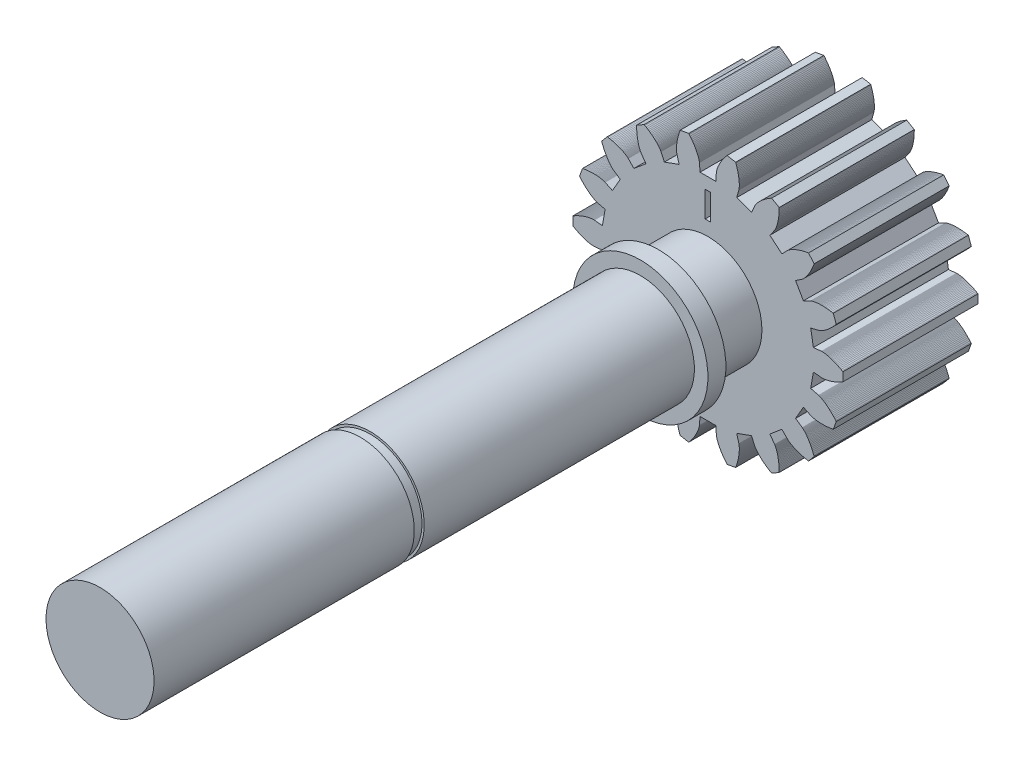
from build123d import *

# Parameters (mm, degrees)
EX_SUN_GEAR_PROFILE_DEPTH = 7.5
SKETCH1_W                 = 0.609653546
SKETCH1_H                 = 2.866842224
CUT_EXTRUDE1_DEPTH        = 1


with BuildPart() as part:
    # SK_Sun_Gear_Profile_DXF → EX_Sun_Gear_Profile (new, symmetric)
    with BuildSketch(Plane.XY):
        Polygon((11.715844, -1.1788231), (12.624043, -1.2701816), (12.6307047, -1.2706619), (12.6421382, -1.2712692), (12.6583493, -1.2718184), (12.6793382, -1.2721246), (12.7050997, -1.2720025), (12.7356234, -1.2712672), (12.7708933, -1.2697341), (12.8108882, -1.2672187), (12.8555814, -1.2635374), (12.9049411, -1.2585073), (12.9589299, -1.2519461), (13.0175052, -1.2436725), (13.0806192, -1.2335066), (13.1482187, -1.2212695), (13.2202453, -1.2067837), (13.2966355, -1.1898733), (13.3773206, -1.1703639), (13.4622268, -1.1480831), (13.5512752, -1.1228603), (13.6443819, -1.0945269), (13.7414581, -1.0629166), (13.84241, -1.0278654), (13.9471389, -0.9892116), (14.0555414, -0.9467962), (14.1675093, -0.9004628), (14.2829298, -0.850058), (14.4016854, -0.795431), (14.5236543, -0.7364343), (14.6487099, -0.6729237), (14.7767214, -0.6047579), (14.9075538, -0.5317993), (14.9739844, -0.4934806), (14.9906948, -0.4837065), (14.9917405, -0.483093), (14.9922286, 0.4827851), (14.9906948, 0.4837065), (14.9739844, 0.4934806), (14.9075538, 0.5317993), (14.7767214, 0.6047579), (14.6487099, 0.6729237), (14.5236543, 0.7364343), (14.4016854, 0.795431), (14.2829298, 0.850058), (14.1675093, 0.9004628), (14.0555414, 0.9467962), (13.9471389, 0.9892116), (13.84241, 1.0278654), (13.7414581, 1.0629166), (13.6443819, 1.0945269), (13.5512752, 1.1228603), (13.4622268, 1.1480831), (13.3773206, 1.1703639), (13.2966355, 1.1898733), (13.2202453, 1.2067837), (13.1482187, 1.2212695), (13.0806192, 1.2335066), (13.0175052, 1.2436725), (12.9589299, 1.2519461), (12.9049411, 1.2585073), (12.8555814, 1.2635374), (12.8108882, 1.2672187), (12.7708933, 1.2697341), (12.7356234, 1.2712672), (12.7050997, 1.2720025), (12.6793382, 1.2721246), (12.6583493, 1.2718184), (12.6421382, 1.2712692), (12.6307047, 1.2706619), (12.624043, 1.2701816), (11.715844, 1.1788231), (11.4124734, 2.8993233), (12.2971477, 3.1240968), (12.3035719, 3.1259238), (12.3145237, 3.1292637), (12.329945, 3.134292), (12.3497728, 3.141183), (12.3739389, 3.1501086), (12.4023703, 3.1612393), (12.4349888, 3.174743), (12.4717114, 3.1907858), (12.5124503, 3.209531), (12.5571128, 3.2311398), (12.6056016, 3.2557706), (12.6578147, 3.2835791), (12.7136455, 3.3147182), (12.7729828, 3.3493377), (12.8357113, 3.3875844), (12.9017109, 3.429602), (12.9708575, 3.4755308), (13.0430227, 3.5255075), (13.1180742, 3.5796656), (13.1958753, 3.6381346), (13.2762857, 3.7010406), (13.3591612, 3.7685055), (13.4443538, 3.8406476), (13.5317119, 3.9175809), (13.6210804, 3.9994153), (13.7123007, 4.0862565), (13.805211, 4.1782059), (13.8996461, 4.2753604), (13.995438, 4.3778124), (14.0924154, 4.4856499), (14.1904043, 4.5989559), (14.239723, 4.6576842), (14.2520826, 4.6725841), (14.2528555, 4.6735183), (13.9229644, 5.5813137), (13.9212079, 5.581655), (13.9021624, 5.5851244), (13.8266322, 5.5984115), (13.6787367, 5.6222229), (13.5351311, 5.6424952), (13.3958954, 5.6594042), (13.2611041, 5.6731271), (13.1308268, 5.6838429), (13.0051275, 5.6917318), (12.8840651, 5.6969757), (12.7676932, 5.6997573), (12.6560598, 5.7002606), (12.5492079, 5.6986704), (12.4471748, 5.6951723), (12.3499925, 5.6899526), (12.2576876, 5.683198), (12.1702814, 5.6750954), (12.0877896, 5.6658323), (12.0102226, 5.6555959), (11.9375853, 5.6445736), (11.8698772, 5.6329523), (11.8070926, 5.6209189), (11.7492201, 5.6086595), (11.6962431, 5.5963598), (11.6481398, 5.5842046), (11.6048828, 5.5723779), (11.5664396, 5.5610625), (11.5327723, 5.5504402), (11.503838, 5.5406914), (11.4795883, 5.5319952), (11.4599699, 5.5245289), (11.4449244, 5.5184682), (11.434388, 5.513987), (11.4282924, 5.5112572), (10.6061109, 5.114786), (9.7325901, 6.6277685), (10.4870349, 7.1415629), (10.4924468, 7.145477), (10.5015958, 7.1523611), (10.5143673, 7.1623607), (10.5306425, 7.1756175), (10.5502985, 7.1922702), (10.5732084, 7.2124537), (10.5992411, 7.2362992), (10.6282622, 7.2639344), (10.6601329, 7.2954826), (10.6947113, 7.3310637), (10.7318517, 7.3707933), (10.7714049, 7.4147826), (10.8132184, 7.463139), (10.8571368, 7.5159653), (10.9030011, 7.5733599), (10.9506495, 7.6354167), (10.9999175, 7.7022252), (11.0506376, 7.7738699), (11.1026398, 7.8504309), (11.1557513, 7.9319834), (11.2097973, 8.0185976), (11.2646004, 8.1103391), (11.3199812, 8.207268), (11.3757582, 8.3094399), (11.4317481, 8.4169049), (11.4877657, 8.5297081), (11.5436243, 8.6478895), (11.5991355, 8.7714836), (11.6541098, 8.9005198), (11.7083562, 9.035022), (11.7616827, 9.175009), (11.7879408, 9.2470636), (11.794459, 9.2652922), (11.7948657, 9.2664343), (11.1743852, 10.0066536), (11.1726179, 10.0063736), (11.1535344, 10.0031197), (11.0780148, 9.9897727), (10.9308945, 9.9615648), (10.7890158, 9.9314986), (10.6523938, 9.8997665), (10.5210379, 9.8665604), (10.3949523, 9.8320725), (10.2741354, 9.796494), (10.1585805, 9.7600158), (10.0482753, 9.7228281), (9.9432021, 9.6851202), (9.843338, 9.6470804), (9.7486546, 9.6088959), (9.6591184, 9.5707527), (9.5746904, 9.5328353), (9.4953267, 9.4953267), (9.4209779, 9.4584083), (9.3515898, 9.4222598), (9.2871029, 9.3870588), (9.2274529, 9.3529809), (9.1725703, 9.3201995), (9.1223808, 9.2888859), (9.0768056, 9.2592088), (9.0357605, 9.2313343), (8.9991572, 9.205426), (8.9669025, 9.1816447), (8.9388987, 9.1601481), (8.9150436, 9.1410912), (8.8952306, 9.1246255), (8.879349, 9.1108996), (8.8672837, 9.1000585), (8.8589154, 9.0922439), (8.854121, 9.0875939), (8.2171243, 8.4338303), (6.8788128, 9.556807), (7.412031, 10.2976511), (7.4157778, 10.3031802), (7.4220205, 10.3127783), (7.4306018, 10.3265429), (7.4413613, 10.3445667), (7.4541364, 10.3669379), (7.4687614, 10.3937398), (7.4850686, 10.425051), (7.5028877, 10.4609453), (7.5220462, 10.5014914), (7.5423698, 10.5467532), (7.563682, 10.5967895), (7.5858046, 10.651654), (7.6085577, 10.7113952), (7.6317598, 10.7760566), (7.655228, 10.8456764), (7.6787782, 10.9202875), (7.7022252, 10.9999175), (7.7253825, 11.0845888), (7.7480631, 11.1743184), (7.7700791, 11.2691179), (7.7912419, 11.3689935), (7.8113625, 11.473946), (7.8302518, 11.5839708), (7.8477202, 11.6990578), (7.8635783, 11.8191915), (7.8776367, 11.9443511), (7.8897062, 12.07451), (7.899598, 12.2096364), (7.9071239, 12.349693), (7.9120964, 12.4946372), (7.9143286, 12.6444207), (7.9143589, 12.7211106), (7.9142495, 12.7404692), (7.9142411, 12.7416816), (7.0780102, 13.2250434), (7.0764453, 13.2241758), (7.0596255, 13.2145912), (6.9932252, 13.1762199), (6.864625, 13.099395), (6.7415859, 13.0226167), (6.6240563, 12.9460707), (6.5119793, 12.8699409), (6.4052931, 12.794409), (6.303931, 12.7196544), (6.2078211, 12.645854), (6.1168871, 12.5731824), (6.0310474, 12.5018114), (5.9502163, 12.4319101), (5.8743029, 12.3636448), (5.8032121, 12.2971787), (5.7368443, 12.232672), (5.6750954, 12.1702814), (5.6178573, 12.1101608), (5.5650173, 12.0524601), (5.5164589, 11.9973261), (5.4720615, 11.9449019), (5.4317006, 11.8953265), (5.3952479, 11.8487355), (5.3625713, 11.8052605), (5.3335352, 11.7650288), (5.3080005, 11.728164), (5.2858247, 11.694785), (5.266862, 11.665007), (5.2509634, 11.6389404), (5.2379769, 11.6166913), (5.2277476, 11.5983613), (5.2201177, 11.5840475), (5.2149269, 11.573842), (5.212012, 11.5678327), (4.8370312, 10.7356301), (3.1953491, 11.3331535), (3.4430267, 12.2116907), (3.4446565, 12.2181678), (3.44724, 12.2293222), (3.450596, 12.2451916), (3.4545422, 12.2658085), (3.4588954, 12.2911998), (3.4634716, 12.3213874), (3.4680863, 12.3563877), (3.4725542, 12.3962118), (3.4766898, 12.4408653), (3.4803072, 12.4903486), (3.4832207, 12.5446565), (3.4852444, 12.6037786), (3.4861926, 12.667699), (3.4858799, 12.7363965), (3.4841215, 12.8098443), (3.4807329, 12.8880104), (3.4755308, 12.9708575), (3.4683323, 13.0583428), (3.4589558, 13.1504183), (3.4472206, 13.2470305), (3.4329477, 13.348121), (3.4159591, 13.4536257), (3.3960785, 13.5634757), (3.3731314, 13.6775967), (3.3469449, 13.7959093), (3.3173484, 13.918329), (3.284173, 14.0447663), (3.2472523, 14.1751269), (3.2064222, 14.3093111), (3.161521, 14.4472147), (3.1123896, 14.5887286), (3.0861886, 14.660804), (3.0794648, 14.6789577), (3.0790422, 14.6800941), (2.1279227, 14.8482977), (2.1267489, 14.8469472), (2.1142216, 14.832188), (2.0649495, 14.7734205), (1.9703805, 14.6572449), (1.8810213, 14.543015), (1.7967599, 14.4308878), (1.7174798, 14.3210166), (1.6430611, 14.213551), (1.5733794, 14.1086367), (1.5083069, 14.0064155), (1.447712, 13.9070253), (1.3914595, 13.8105996), (1.3394106, 13.717268), (1.2914235, 13.6271557), (1.2473527, 13.5403835), (1.20705, 13.4570679), (1.1703639, 13.3773206), (1.1371401, 13.301249), (1.1072215, 13.2289558), (1.0804485, 13.1605389), (1.0566588, 13.0960914), (1.0356877, 13.0357016), (1.0173684, 12.9794528), (1.0015318, 12.9274236), (0.9880068, 12.8796873), (0.9766206, 12.8363122), (0.9671984, 12.7973617), (0.959564, 12.7628939), (0.9535395, 12.7329616), (0.9489458, 12.7076127), (0.9456026, 12.6868895), (0.9433285, 12.6708293), (0.9419412, 12.659464), (0.9412574, 12.6528201), (0.8735208, 11.7425545), (-0.8735208, 11.7425545), (-0.9412574, 12.6528201), (-0.9419412, 12.659464), (-0.9433285, 12.6708293), (-0.9456026, 12.6868895), (-0.9489458, 12.7076127), (-0.9535395, 12.7329616), (-0.959564, 12.7628939), (-0.9671984, 12.7973617), (-0.9766206, 12.8363122), (-0.9880068, 12.8796873), (-1.0015318, 12.9274236), (-1.0173684, 12.9794528), (-1.0356877, 13.0357016), (-1.0566588, 13.0960914), (-1.0804485, 13.1605389), (-1.1072215, 13.2289558), (-1.1371401, 13.301249), (-1.1703639, 13.3773206), (-1.20705, 13.4570679), (-1.2473527, 13.5403835), (-1.2914235, 13.6271557), (-1.3394106, 13.717268), (-1.3914595, 13.8105996), (-1.447712, 13.9070253), (-1.5083069, 14.0064155), (-1.5733794, 14.1086367), (-1.6430611, 14.213551), (-1.7174798, 14.3210166), (-1.7967599, 14.4308878), (-1.8810213, 14.543015), (-1.9703805, 14.6572449), (-2.0649495, 14.7734205), (-2.1142216, 14.832188), (-2.1267489, 14.8469472), (-2.1275347, 14.8478705), (-3.0788237, 14.6806282), (-3.0794648, 14.6789577), (-3.0861886, 14.660804), (-3.1123896, 14.5887286), (-3.161521, 14.4472147), (-3.2064222, 14.3093111), (-3.2472523, 14.1751269), (-3.284173, 14.0447663), (-3.3173484, 13.918329), (-3.3469449, 13.7959093), (-3.3731314, 13.6775967), (-3.3960785, 13.5634757), (-3.4159591, 13.4536257), (-3.4329477, 13.348121), (-3.4472206, 13.2470305), (-3.4589558, 13.1504183), (-3.4683323, 13.0583428), (-3.4755308, 12.9708575), (-3.4807329, 12.8880104), (-3.4841215, 12.8098443), (-3.4858799, 12.7363965), (-3.4861926, 12.667699), (-3.4852444, 12.6037786), (-3.4832207, 12.5446565), (-3.4803072, 12.4903486), (-3.4766898, 12.4408653), (-3.4725542, 12.3962118), (-3.4680863, 12.3563877), (-3.4634716, 12.3213874), (-3.4588954, 12.2911998), (-3.4545422, 12.2658085), (-3.450596, 12.2451916), (-3.44724, 12.2293222), (-3.4446565, 12.2181678), (-3.4430267, 12.2116907), (-3.1953491, 11.3331535), (-4.8370312, 10.7356301), (-5.212012, 11.5678327), (-5.2149269, 11.573842), (-5.2201177, 11.5840475), (-5.2277476, 11.5983613), (-5.2379769, 11.6166913), (-5.2509634, 11.6389404), (-5.266862, 11.665007), (-5.2858247, 11.694785), (-5.3080005, 11.728164), (-5.3335352, 11.7650288), (-5.3625713, 11.8052605), (-5.3952479, 11.8487355), (-5.4317006, 11.8953265), (-5.4720615, 11.9449019), (-5.5164589, 11.9973261), (-5.5650173, 12.0524601), (-5.6178573, 12.1101608), (-5.6750954, 12.1702814), (-5.7368443, 12.232672), (-5.8032121, 12.2971787), (-5.8743029, 12.3636448), (-5.9502163, 12.4319101), (-6.0310474, 12.5018114), (-6.1168871, 12.5731824), (-6.2078211, 12.645854), (-6.303931, 12.7196544), (-6.4052931, 12.794409), (-6.5119793, 12.8699409), (-6.6240563, 12.9460707), (-6.7415859, 13.0226167), (-6.864625, 13.099395), (-6.9932252, 13.1762199), (-7.0596255, 13.2145912), (-7.0764453, 13.2241758), (-7.0774994, 13.2247747), (-7.9142184, 12.7422583), (-7.9142495, 12.7404692), (-7.9143589, 12.7211106), (-7.9143286, 12.6444207), (-7.9120964, 12.4946372), (-7.9071239, 12.349693), (-7.899598, 12.2096364), (-7.8897062, 12.07451), (-7.8776367, 11.9443511), (-7.8635783, 11.8191915), (-7.8477202, 11.6990578), (-7.8302518, 11.5839708), (-7.8113625, 11.473946), (-7.7912419, 11.3689935), (-7.7700791, 11.2691179), (-7.7480631, 11.1743184), (-7.7253825, 11.0845888), (-7.7022252, 10.9999175), (-7.6787782, 10.9202875), (-7.655228, 10.8456764), (-7.6317598, 10.7760566), (-7.6085577, 10.7113952), (-7.5858046, 10.651654), (-7.563682, 10.5967895), (-7.5423698, 10.5467532), (-7.5220462, 10.5014914), (-7.5028877, 10.4609453), (-7.4850686, 10.425051), (-7.4687614, 10.3937398), (-7.4541364, 10.3669379), (-7.4413613, 10.3445667), (-7.4306018, 10.3265429), (-7.4220205, 10.3127783), (-7.4157778, 10.3031802), (-7.412031, 10.2976511), (-6.8788128, 9.556807), (-8.2171243, 8.4338303), (-8.854121, 9.0875939), (-8.8589154, 9.0922439), (-8.8672837, 9.1000585), (-8.879349, 9.1108996), (-8.8952306, 9.1246255), (-8.9150436, 9.1410912), (-8.9388987, 9.1601481), (-8.9669025, 9.1816447), (-8.9991572, 9.205426), (-9.0357605, 9.2313343), (-9.0768056, 9.2592088), (-9.1223808, 9.2888859), (-9.1725703, 9.3201995), (-9.2274529, 9.3529809), (-9.2871029, 9.3870588), (-9.3515898, 9.4222598), (-9.4209779, 9.4584083), (-9.4953267, 9.4953267), (-9.5746904, 9.5328353), (-9.6591184, 9.5707527), (-9.7486546, 9.6088959), (-9.843338, 9.6470804), (-9.9432021, 9.6851202), (-10.0482753, 9.7228281), (-10.1585805, 9.7600158), (-10.2741354, 9.796494), (-10.3949523, 9.8320725), (-10.5210379, 9.8665604), (-10.6523938, 9.8997665), (-10.7890158, 9.9314986), (-10.9308945, 9.9615648), (-11.0780148, 9.9897727), (-11.1535344, 10.0031197), (-11.1726179, 10.0063736), (-11.1738133, 10.0065758), (-11.7950417, 9.266984), (-11.794459, 9.2652922), (-11.7879408, 9.2470636), (-11.7616827, 9.175009), (-11.7083562, 9.035022), (-11.6541098, 8.9005198), (-11.5991355, 8.7714836), (-11.5436243, 8.6478895), (-11.4877657, 8.5297081), (-11.4317481, 8.4169049), (-11.3757582, 8.3094399), (-11.3199812, 8.207268), (-11.2646004, 8.1103391), (-11.2097973, 8.0185976), (-11.1557513, 7.9319834), (-11.1026398, 7.8504309), (-11.0506376, 7.7738699), (-10.9999175, 7.7022252), (-10.9506495, 7.6354167), (-10.9030011, 7.5733599), (-10.8571368, 7.5159653), (-10.8132184, 7.463139), (-10.7714049, 7.4147826), (-10.7318517, 7.3707933), (-10.6947113, 7.3310637), (-10.6601329, 7.2954826), (-10.6282622, 7.2639344), (-10.5992411, 7.2362992), (-10.5732084, 7.2124537), (-10.5502985, 7.1922702), (-10.5306425, 7.1756175), (-10.5143673, 7.1623607), (-10.5015958, 7.1523611), (-10.4924468, 7.145477), (-10.4870349, 7.1415629), (-9.7325901, 6.6277685), (-10.6061109, 5.114786), (-11.4282924, 5.5112572), (-11.434388, 5.513987), (-11.4449244, 5.5184682), (-11.4599699, 5.5245289), (-11.4795883, 5.5319952), (-11.503838, 5.5406914), (-11.5327723, 5.5504402), (-11.5664396, 5.5610625), (-11.6048828, 5.5723779), (-11.6481398, 5.5842046), (-11.6962431, 5.5963598), (-11.7492201, 5.6086595), (-11.8070926, 5.6209189), (-11.8698772, 5.6329523), (-11.9375853, 5.6445736), (-12.0102226, 5.6555959), (-12.0877896, 5.6658323), (-12.1702814, 5.6750954), (-12.2576876, 5.683198), (-12.3499925, 5.6899526), (-12.4471748, 5.6951723), (-12.5492079, 5.6986704), (-12.6560598, 5.7002606), (-12.7676932, 5.6997573), (-12.8840651, 5.6969757), (-13.0051275, 5.6917318), (-13.1308268, 5.6838429), (-13.2611041, 5.6731271), (-13.3958954, 5.6594042), (-13.5351311, 5.6424952), (-13.6787367, 5.6222229), (-13.8266322, 5.5984115), (-13.9021624, 5.5851244), (-13.9212079, 5.581655), (-13.9224004, 5.5814362), (-14.2532088, 4.6739746), (-14.2520826, 4.6725841), (-14.239723, 4.6576842), (-14.1904043, 4.5989559), (-14.0924154, 4.4856499), (-13.995438, 4.3778124), (-13.8996461, 4.2753604), (-13.805211, 4.1782059), (-13.7123007, 4.0862565), (-13.6210804, 3.9994153), (-13.5317119, 3.9175809), (-13.4443538, 3.8406476), (-13.3591612, 3.7685055), (-13.2762857, 3.7010406), (-13.1958753, 3.6381346), (-13.1180742, 3.5796656), (-13.0430227, 3.5255075), (-12.9708575, 3.4755308), (-12.9017109, 3.429602), (-12.8357113, 3.3875844), (-12.7729828, 3.3493377), (-12.7136455, 3.3147182), (-12.6578147, 3.2835791), (-12.6056016, 3.2557706), (-12.5571128, 3.2311398), (-12.5124503, 3.209531), (-12.4717114, 3.1907858), (-12.4349888, 3.174743), (-12.4023703, 3.1612393), (-12.3739389, 3.1501086), (-12.3497728, 3.141183), (-12.329945, 3.134292), (-12.3145237, 3.1292637), (-12.3035719, 3.1259238), (-12.2971477, 3.1240968), (-11.4124734, 2.8993233), (-11.715844, 1.1788231), (-12.624043, 1.2701816), (-12.6307047, 1.2706619), (-12.6421382, 1.2712692), (-12.6583493, 1.2718184), (-12.6793382, 1.2721246), (-12.7050997, 1.2720025), (-12.7356234, 1.2712672), (-12.7708933, 1.2697341), (-12.8108882, 1.2672187), (-12.8555814, 1.2635374), (-12.9049411, 1.2585073), (-12.9589299, 1.2519461), (-13.0175052, 1.2436725), (-13.0806192, 1.2335066), (-13.1482187, 1.2212695), (-13.2202453, 1.2067837), (-13.2966355, 1.1898733), (-13.3773206, 1.1703639), (-13.4622268, 1.1480831), (-13.5512752, 1.1228603), (-13.6443819, 1.0945269), (-13.7414581, 1.0629166), (-13.84241, 1.0278654), (-13.9471389, 0.9892116), (-14.0555414, 0.9467962), (-14.1675093, 0.9004628), (-14.2829298, 0.850058), (-14.4016854, 0.795431), (-14.5236543, 0.7364343), (-14.6487099, 0.6729237), (-14.7767214, 0.6047579), (-14.9075538, 0.5317993), (-14.9739844, 0.4934806), (-14.9906948, 0.4837065), (-14.9917405, 0.483093), (-14.9922286, -0.4827851), (-14.9906948, -0.4837065), (-14.9739844, -0.4934806), (-14.9075538, -0.5317993), (-14.7767214, -0.6047579), (-14.6487099, -0.6729237), (-14.5236543, -0.7364343), (-14.4016854, -0.795431), (-14.2829298, -0.850058), (-14.1675093, -0.9004628), (-14.0555414, -0.9467962), (-13.9471389, -0.9892116), (-13.84241, -1.0278654), (-13.7414581, -1.0629166), (-13.6443819, -1.0945269), (-13.5512752, -1.1228603), (-13.4622268, -1.1480831), (-13.3773206, -1.1703639), (-13.2966355, -1.1898733), (-13.2202453, -1.2067837), (-13.1482187, -1.2212695), (-13.0806192, -1.2335066), (-13.0175052, -1.2436725), (-12.9589299, -1.2519461), (-12.9049411, -1.2585073), (-12.8555814, -1.2635374), (-12.8108882, -1.2672187), (-12.7708933, -1.2697341), (-12.7356234, -1.2712672), (-12.7050997, -1.2720025), (-12.6793382, -1.2721246), (-12.6583493, -1.2718184), (-12.6421382, -1.2712692), (-12.6307047, -1.2706619), (-12.624043, -1.2701816), (-11.715844, -1.1788231), (-11.4124734, -2.8993233), (-12.2971477, -3.1240968), (-12.3035719, -3.1259238), (-12.3145237, -3.1292637), (-12.329945, -3.134292), (-12.3497728, -3.141183), (-12.3739389, -3.1501086), (-12.4023703, -3.1612393), (-12.4349888, -3.174743), (-12.4717114, -3.1907858), (-12.5124503, -3.209531), (-12.5571128, -3.2311398), (-12.6056016, -3.2557706), (-12.6578147, -3.2835791), (-12.7136455, -3.3147182), (-12.7729828, -3.3493377), (-12.8357113, -3.3875844), (-12.9017109, -3.429602), (-12.9708575, -3.4755308), (-13.0430227, -3.5255075), (-13.1180742, -3.5796656), (-13.1958753, -3.6381346), (-13.2762857, -3.7010406), (-13.3591612, -3.7685055), (-13.4443538, -3.8406476), (-13.5317119, -3.9175809), (-13.6210804, -3.9994153), (-13.7123007, -4.0862565), (-13.805211, -4.1782059), (-13.8996461, -4.2753604), (-13.995438, -4.3778124), (-14.0924154, -4.4856499), (-14.1904043, -4.5989559), (-14.239723, -4.6576842), (-14.2520826, -4.6725841), (-14.2528555, -4.6735183), (-13.9229644, -5.5813137), (-13.9212079, -5.581655), (-13.9021624, -5.5851244), (-13.8266322, -5.5984115), (-13.6787367, -5.6222229), (-13.5351311, -5.6424952), (-13.3958954, -5.6594042), (-13.2611041, -5.6731271), (-13.1308268, -5.6838429), (-13.0051275, -5.6917318), (-12.8840651, -5.6969757), (-12.7676932, -5.6997573), (-12.6560598, -5.7002606), (-12.5492079, -5.6986704), (-12.4471748, -5.6951723), (-12.3499925, -5.6899526), (-12.2576876, -5.683198), (-12.1702814, -5.6750954), (-12.0877896, -5.6658323), (-12.0102226, -5.6555959), (-11.9375853, -5.6445736), (-11.8698772, -5.6329523), (-11.8070926, -5.6209189), (-11.7492201, -5.6086595), (-11.6962431, -5.5963598), (-11.6481398, -5.5842046), (-11.6048828, -5.5723779), (-11.5664396, -5.5610625), (-11.5327723, -5.5504402), (-11.503838, -5.5406914), (-11.4795883, -5.5319952), (-11.4599699, -5.5245289), (-11.4449244, -5.5184682), (-11.434388, -5.513987), (-11.4282924, -5.5112572), (-10.6061109, -5.114786), (-9.7325901, -6.6277685), (-10.4870349, -7.1415629), (-10.4924468, -7.145477), (-10.5015958, -7.1523611), (-10.5143673, -7.1623607), (-10.5306425, -7.1756175), (-10.5502985, -7.1922702), (-10.5732084, -7.2124537), (-10.5992411, -7.2362992), (-10.6282622, -7.2639344), (-10.6601329, -7.2954826), (-10.6947113, -7.3310637), (-10.7318517, -7.3707933), (-10.7714049, -7.4147826), (-10.8132184, -7.463139), (-10.8571368, -7.5159653), (-10.9030011, -7.5733599), (-10.9506495, -7.6354167), (-10.9999175, -7.7022252), (-11.0506376, -7.7738699), (-11.1026398, -7.8504309), (-11.1557513, -7.9319834), (-11.2097973, -8.0185976), (-11.2646004, -8.1103391), (-11.3199812, -8.207268), (-11.3757582, -8.3094399), (-11.4317481, -8.4169049), (-11.4877657, -8.5297081), (-11.5436243, -8.6478895), (-11.5991355, -8.7714836), (-11.6541098, -8.9005198), (-11.7083562, -9.035022), (-11.7616827, -9.175009), (-11.7879408, -9.2470636), (-11.794459, -9.2652922), (-11.7948657, -9.2664343), (-11.1743852, -10.0066536), (-11.1726179, -10.0063736), (-11.1535344, -10.0031197), (-11.0780148, -9.9897727), (-10.9308945, -9.9615648), (-10.7890158, -9.9314986), (-10.6523938, -9.8997665), (-10.5210379, -9.8665604), (-10.3949523, -9.8320725), (-10.2741354, -9.796494), (-10.1585805, -9.7600158), (-10.0482753, -9.7228281), (-9.9432021, -9.6851202), (-9.843338, -9.6470804), (-9.7486546, -9.6088959), (-9.6591184, -9.5707527), (-9.5746904, -9.5328353), (-9.4953267, -9.4953267), (-9.4209779, -9.4584083), (-9.3515898, -9.4222598), (-9.2871029, -9.3870588), (-9.2274529, -9.3529809), (-9.1725703, -9.3201995), (-9.1223808, -9.2888859), (-9.0768056, -9.2592088), (-9.0357605, -9.2313343), (-8.9991572, -9.205426), (-8.9669025, -9.1816447), (-8.9388987, -9.1601481), (-8.9150436, -9.1410912), (-8.8952306, -9.1246255), (-8.879349, -9.1108996), (-8.8672837, -9.1000585), (-8.8589154, -9.0922439), (-8.854121, -9.0875939), (-8.2171243, -8.4338303), (-6.8788128, -9.556807), (-7.412031, -10.2976511), (-7.4157778, -10.3031802), (-7.4220205, -10.3127783), (-7.4306018, -10.3265429), (-7.4413613, -10.3445667), (-7.4541364, -10.3669379), (-7.4687614, -10.3937398), (-7.4850686, -10.425051), (-7.5028877, -10.4609453), (-7.5220462, -10.5014914), (-7.5423698, -10.5467532), (-7.563682, -10.5967895), (-7.5858046, -10.651654), (-7.6085577, -10.7113952), (-7.6317598, -10.7760566), (-7.655228, -10.8456764), (-7.6787782, -10.9202875), (-7.7022252, -10.9999175), (-7.7253825, -11.0845888), (-7.7480631, -11.1743184), (-7.7700791, -11.2691179), (-7.7912419, -11.3689935), (-7.8113625, -11.473946), (-7.8302518, -11.5839708), (-7.8477202, -11.6990578), (-7.8635783, -11.8191915), (-7.8776367, -11.9443511), (-7.8897062, -12.07451), (-7.899598, -12.2096364), (-7.9071239, -12.349693), (-7.9120964, -12.4946372), (-7.9143286, -12.6444207), (-7.9143589, -12.7211106), (-7.9142495, -12.7404692), (-7.9142411, -12.7416816), (-7.0780102, -13.2250434), (-7.0764453, -13.2241758), (-7.0596255, -13.2145912), (-6.9932252, -13.1762199), (-6.864625, -13.099395), (-6.7415859, -13.0226167), (-6.6240563, -12.9460707), (-6.5119793, -12.8699409), (-6.4052931, -12.794409), (-6.303931, -12.7196544), (-6.2078211, -12.645854), (-6.1168871, -12.5731824), (-6.0310474, -12.5018114), (-5.9502163, -12.4319101), (-5.8743029, -12.3636448), (-5.8032121, -12.2971787), (-5.7368443, -12.232672), (-5.6750954, -12.1702814), (-5.6178573, -12.1101608), (-5.5650173, -12.0524601), (-5.5164589, -11.9973261), (-5.4720615, -11.9449019), (-5.4317006, -11.8953265), (-5.3952479, -11.8487355), (-5.3625713, -11.8052605), (-5.3335352, -11.7650288), (-5.3080005, -11.728164), (-5.2858247, -11.694785), (-5.266862, -11.665007), (-5.2509634, -11.6389404), (-5.2379769, -11.6166913), (-5.2277476, -11.5983613), (-5.2201177, -11.5840475), (-5.2149269, -11.573842), (-5.212012, -11.5678327), (-4.8370312, -10.7356301), (-3.1953491, -11.3331535), (-3.4430267, -12.2116907), (-3.4446565, -12.2181678), (-3.44724, -12.2293222), (-3.450596, -12.2451916), (-3.4545422, -12.2658085), (-3.4588954, -12.2911998), (-3.4634716, -12.3213874), (-3.4680863, -12.3563877), (-3.4725542, -12.3962118), (-3.4766898, -12.4408653), (-3.4803072, -12.4903486), (-3.4832207, -12.5446565), (-3.4852444, -12.6037786), (-3.4861926, -12.667699), (-3.4858799, -12.7363965), (-3.4841215, -12.8098443), (-3.4807329, -12.8880104), (-3.4755308, -12.9708575), (-3.4683323, -13.0583428), (-3.4589558, -13.1504183), (-3.4472206, -13.2470305), (-3.4329477, -13.348121), (-3.4159591, -13.4536257), (-3.3960785, -13.5634757), (-3.3731314, -13.6775967), (-3.3469449, -13.7959093), (-3.3173484, -13.918329), (-3.284173, -14.0447663), (-3.2472523, -14.1751269), (-3.2064222, -14.3093111), (-3.161521, -14.4472147), (-3.1123896, -14.5887286), (-3.0861886, -14.660804), (-3.0794648, -14.6789577), (-3.0790422, -14.6800941), (-2.1279227, -14.8482977), (-2.1267489, -14.8469472), (-2.1142216, -14.832188), (-2.0649495, -14.7734205), (-1.9703805, -14.6572449), (-1.8810213, -14.543015), (-1.7967599, -14.4308878), (-1.7174798, -14.3210166), (-1.6430611, -14.213551), (-1.5733794, -14.1086367), (-1.5083069, -14.0064155), (-1.447712, -13.9070253), (-1.3914595, -13.8105996), (-1.3394106, -13.717268), (-1.2914235, -13.6271557), (-1.2473527, -13.5403835), (-1.20705, -13.4570679), (-1.1703639, -13.3773206), (-1.1371401, -13.301249), (-1.1072215, -13.2289558), (-1.0804485, -13.1605389), (-1.0566588, -13.0960914), (-1.0356877, -13.0357016), (-1.0173684, -12.9794528), (-1.0015318, -12.9274236), (-0.9880068, -12.8796873), (-0.9766206, -12.8363122), (-0.9671984, -12.7973617), (-0.959564, -12.7628939), (-0.9535395, -12.7329616), (-0.9489458, -12.7076127), (-0.9456026, -12.6868895), (-0.9433285, -12.6708293), (-0.9419412, -12.659464), (-0.9412574, -12.6528201), (-0.8735208, -11.7425545), (0.8735208, -11.7425545), (0.9412574, -12.6528201), (0.9419412, -12.659464), (0.9433285, -12.6708293), (0.9456026, -12.6868895), (0.9489458, -12.7076127), (0.9535395, -12.7329616), (0.959564, -12.7628939), (0.9671984, -12.7973617), (0.9766206, -12.8363122), (0.9880068, -12.8796873), (1.0015318, -12.9274236), (1.0173684, -12.9794528), (1.0356877, -13.0357016), (1.0566588, -13.0960914), (1.0804485, -13.1605389), (1.1072215, -13.2289558), (1.1371401, -13.301249), (1.1703639, -13.3773206), (1.20705, -13.4570679), (1.2473527, -13.5403835), (1.2914235, -13.6271557), (1.3394106, -13.717268), (1.3914595, -13.8105996), (1.447712, -13.9070253), (1.5083069, -14.0064155), (1.5733794, -14.1086367), (1.6430611, -14.213551), (1.7174798, -14.3210166), (1.7967599, -14.4308878), (1.8810213, -14.543015), (1.9703805, -14.6572449), (2.0649495, -14.7734205), (2.1142216, -14.832188), (2.1267489, -14.8469472), (2.1275347, -14.8478705), (3.0788237, -14.6806282), (3.0794648, -14.6789577), (3.0861886, -14.660804), (3.1123896, -14.5887286), (3.161521, -14.4472147), (3.2064222, -14.3093111), (3.2472523, -14.1751269), (3.284173, -14.0447663), (3.3173484, -13.918329), (3.3469449, -13.7959093), (3.3731314, -13.6775967), (3.3960785, -13.5634757), (3.4159591, -13.4536257), (3.4329477, -13.348121), (3.4472206, -13.2470305), (3.4589558, -13.1504183), (3.4683323, -13.0583428), (3.4755308, -12.9708575), (3.4807329, -12.8880104), (3.4841215, -12.8098443), (3.4858799, -12.7363965), (3.4861926, -12.667699), (3.4852444, -12.6037786), (3.4832207, -12.5446565), (3.4803072, -12.4903486), (3.4766898, -12.4408653), (3.4725542, -12.3962118), (3.4680863, -12.3563877), (3.4634716, -12.3213874), (3.4588954, -12.2911998), (3.4545422, -12.2658085), (3.450596, -12.2451916), (3.44724, -12.2293222), (3.4446565, -12.2181678), (3.4430267, -12.2116907), (3.1953491, -11.3331535), (4.8370312, -10.7356301), (5.212012, -11.5678327), (5.2149269, -11.573842), (5.2201177, -11.5840475), (5.2277476, -11.5983613), (5.2379769, -11.6166913), (5.2509634, -11.6389404), (5.266862, -11.665007), (5.2858247, -11.694785), (5.3080005, -11.728164), (5.3335352, -11.7650288), (5.3625713, -11.8052605), (5.3952479, -11.8487355), (5.4317006, -11.8953265), (5.4720615, -11.9449019), (5.5164589, -11.9973261), (5.5650173, -12.0524601), (5.6178573, -12.1101608), (5.6750954, -12.1702814), (5.7368443, -12.232672), (5.8032121, -12.2971787), (5.8743029, -12.3636448), (5.9502163, -12.4319101), (6.0310474, -12.5018114), (6.1168871, -12.5731824), (6.2078211, -12.645854), (6.303931, -12.7196544), (6.4052931, -12.794409), (6.5119793, -12.8699409), (6.6240563, -12.9460707), (6.7415859, -13.0226167), (6.864625, -13.099395), (6.9932252, -13.1762199), (7.0596255, -13.2145912), (7.0764453, -13.2241758), (7.0774994, -13.2247747), (7.9142184, -12.7422583), (7.9142495, -12.7404692), (7.9143589, -12.7211106), (7.9143286, -12.6444207), (7.9120964, -12.4946372), (7.9071239, -12.349693), (7.899598, -12.2096364), (7.8897062, -12.07451), (7.8776367, -11.9443511), (7.8635783, -11.8191915), (7.8477202, -11.6990578), (7.8302518, -11.5839708), (7.8113625, -11.473946), (7.7912419, -11.3689935), (7.7700791, -11.2691179), (7.7480631, -11.1743184), (7.7253825, -11.0845888), (7.7022252, -10.9999175), (7.6787782, -10.9202875), (7.655228, -10.8456764), (7.6317598, -10.7760566), (7.6085577, -10.7113952), (7.5858046, -10.651654), (7.563682, -10.5967895), (7.5423698, -10.5467532), (7.5220462, -10.5014914), (7.5028877, -10.4609453), (7.4850686, -10.425051), (7.4687614, -10.3937398), (7.4541364, -10.3669379), (7.4413613, -10.3445667), (7.4306018, -10.3265429), (7.4220205, -10.3127783), (7.4157778, -10.3031802), (7.412031, -10.2976511), (6.8788128, -9.556807), (8.2171243, -8.4338303), (8.854121, -9.0875939), (8.8589154, -9.0922439), (8.8672837, -9.1000585), (8.879349, -9.1108996), (8.8952306, -9.1246255), (8.9150436, -9.1410912), (8.9388987, -9.1601481), (8.9669025, -9.1816447), (8.9991572, -9.205426), (9.0357605, -9.2313343), (9.0768056, -9.2592088), (9.1223808, -9.2888859), (9.1725703, -9.3201995), (9.2274529, -9.3529809), (9.2871029, -9.3870588), (9.3515898, -9.4222598), (9.4209779, -9.4584083), (9.4953267, -9.4953267), (9.5746904, -9.5328353), (9.6591184, -9.5707527), (9.7486546, -9.6088959), (9.843338, -9.6470804), (9.9432021, -9.6851202), (10.0482753, -9.7228281), (10.1585805, -9.7600158), (10.2741354, -9.796494), (10.3949523, -9.8320725), (10.5210379, -9.8665604), (10.6523938, -9.8997665), (10.7890158, -9.9314986), (10.9308945, -9.9615648), (11.0780148, -9.9897727), (11.1535344, -10.0031197), (11.1726179, -10.0063736), (11.1738133, -10.0065758), (11.7950417, -9.266984), (11.794459, -9.2652922), (11.7879408, -9.2470636), (11.7616827, -9.175009), (11.7083562, -9.035022), (11.6541098, -8.9005198), (11.5991355, -8.7714836), (11.5436243, -8.6478895), (11.4877657, -8.5297081), (11.4317481, -8.4169049), (11.3757582, -8.3094399), (11.3199812, -8.207268), (11.2646004, -8.1103391), (11.2097973, -8.0185976), (11.1557513, -7.9319834), (11.1026398, -7.8504309), (11.0506376, -7.7738699), (10.9999175, -7.7022252), (10.9506495, -7.6354167), (10.9030011, -7.5733599), (10.8571368, -7.5159653), (10.8132184, -7.463139), (10.7714049, -7.4147826), (10.7318517, -7.3707933), (10.6947113, -7.3310637), (10.6601329, -7.2954826), (10.6282622, -7.2639344), (10.5992411, -7.2362992), (10.5732084, -7.2124537), (10.5502985, -7.1922702), (10.5306425, -7.1756175), (10.5143673, -7.1623607), (10.5015958, -7.1523611), (10.4924468, -7.145477), (10.4870349, -7.1415629), (9.7325901, -6.6277685), (10.6061109, -5.114786), (11.4282924, -5.5112572), (11.434388, -5.513987), (11.4449244, -5.5184682), (11.4599699, -5.5245289), (11.4795883, -5.5319952), (11.503838, -5.5406914), (11.5327723, -5.5504402), (11.5664396, -5.5610625), (11.6048828, -5.5723779), (11.6481398, -5.5842046), (11.6962431, -5.5963598), (11.7492201, -5.6086595), (11.8070926, -5.6209189), (11.8698772, -5.6329523), (11.9375853, -5.6445736), (12.0102226, -5.6555959), (12.0877896, -5.6658323), (12.1702814, -5.6750954), (12.2576876, -5.683198), (12.3499925, -5.6899526), (12.4471748, -5.6951723), (12.5492079, -5.6986704), (12.6560598, -5.7002606), (12.7676932, -5.6997573), (12.8840651, -5.6969757), (13.0051275, -5.6917318), (13.1308268, -5.6838429), (13.2611041, -5.6731271), (13.3958954, -5.6594042), (13.5351311, -5.6424952), (13.6787367, -5.6222229), (13.8266322, -5.5984115), (13.9021624, -5.5851244), (13.9212079, -5.581655), (13.9224004, -5.5814362), (14.2532088, -4.6739746), (14.2520826, -4.6725841), (14.239723, -4.6576842), (14.1904043, -4.5989559), (14.0924154, -4.4856499), (13.995438, -4.3778124), (13.8996461, -4.2753604), (13.805211, -4.1782059), (13.7123007, -4.0862565), (13.6210804, -3.9994153), (13.5317119, -3.9175809), (13.4443538, -3.8406476), (13.3591612, -3.7685055), (13.2762857, -3.7010406), (13.1958753, -3.6381346), (13.1180742, -3.5796656), (13.0430227, -3.5255075), (12.9708575, -3.4755308), (12.9017109, -3.429602), (12.8357113, -3.3875844), (12.7729828, -3.3493377), (12.7136455, -3.3147182), (12.6578147, -3.2835791), (12.6056016, -3.2557706), (12.5571128, -3.2311398), (12.5124503, -3.209531), (12.4717114, -3.1907858), (12.4349888, -3.174743), (12.4023703, -3.1612393), (12.3739389, -3.1501086), (12.3497728, -3.141183), (12.329945, -3.134292), (12.3145237, -3.1292637), (12.3035719, -3.1259238), (12.2971477, -3.1240968), (11.4124734, -2.8993233), align=None)
    extrude(amount=EX_SUN_GEAR_PROFILE_DEPTH, both=True)

    # Sketch1 → Cut-Extrude1 (cut)
    with BuildSketch(Plane.XY.offset(7.5)):
        with Locations((0, 8.958881949)):
            Rectangle(SKETCH1_W, SKETCH1_H)
    cut_extrude1 = extrude(amount=-CUT_EXTRUDE1_DEPTH, mode=Mode.SUBTRACT)

    # Mirror1: Cut-Extrude1 across plane
    add(cut_extrude1.mirror(Plane.XY), mode=Mode.SUBTRACT)

    # Sketch2 → Revolve1 (revolve)
    with BuildSketch(Plane(origin=(0, 0, 0), x_dir=(0, 0, -1), z_dir=(1, 0, 0))):
        Polygon((-7, 0), (-7, 6), (-13, 6), (-13, 7.5), (-15, 7.5), (-15, 6), (-45, 6), (-45, 5.75), (-46.1, 5.75), (-46.1, 6), (-75, 6), (-75, 0), align=None)
    revolve(axis=Axis((0, 0, 0), (0, 0, 1)))


solid = part.part
